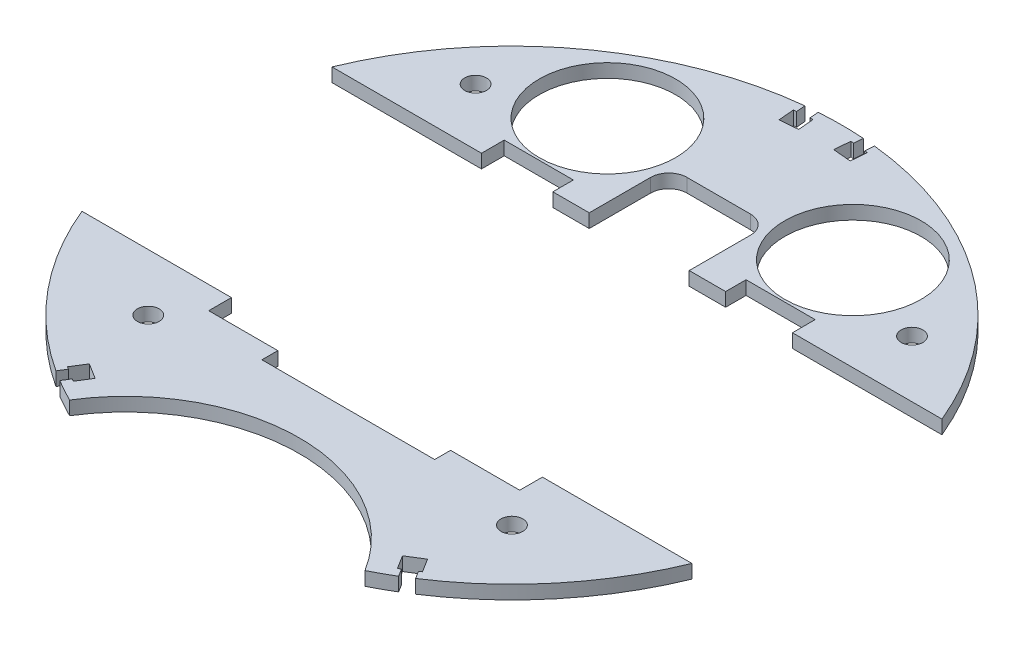
from build123d import *

# Parameters (mm, degrees)
BOSS_EXTRUDE1_DEPTH  = 3
SOLENOID_PLACEMENT_W = 38
SOLENOID_PLACEMENT_H = 64
CUT_EXTRUDE1_DEPTH   = 103.574363269
SKETCH3_R            = 12
CUT_EXTRUDE3_DEPTH   = 103.574363269
SKETCH4_R            = 2.4
CUT_EXTRUDE4_DEPTH   = 103.574363269
CUT_EXTRUDE2_DEPTH   = 103.574363269
CUT_EXTRUDE5_DEPTH   = 99.819279495
SKETCH6_R            = 15
CUT_EXTRUDE10_DEPTH  = 99.819279495
CUT_EXTRUDE11_DEPTH  = 99.819279495


with BuildPart() as part:
    # Sketch1 → Boss-Extrude1 (new body)
    with BuildSketch(Plane(origin=(0, 0, 0), x_dir=(1, 0, 0), z_dir=(0, 1, 0))):
        with BuildLine():
            ThreePointArc((32.48910875, -64.812867647), (0, 72.5), (-32.48910875, -64.812867647))
            ThreePointArc((-32.48910875, -64.812867647), (0, -46.75), (32.48910875, -64.812867647))
        make_face()
    extrude(amount=BOSS_EXTRUDE1_DEPTH)

    # solenoid placement → Cut-Extrude1 (cut, through all)
    with BuildSketch(Plane(origin=(0, 3, 0), x_dir=(1, 0, 0), z_dir=(0, 1, 0))):
        with Locations((0, -4)):
            Rectangle(SOLENOID_PLACEMENT_W, SOLENOID_PLACEMENT_H)
    extrude(amount=-CUT_EXTRUDE1_DEPTH, mode=Mode.SUBTRACT)

    # Sketch3 → Cut-Extrude3 (cut, through all)
    with BuildSketch(Plane(origin=(0, 3, 0), x_dir=(1, 0, 0), z_dir=(0, 1, 0))):
        with Locations((27, 48)):
            Circle(SKETCH3_R)
        with Locations((-27, 48)):
            Circle(SKETCH3_R)
    extrude(amount=-CUT_EXTRUDE3_DEPTH, mode=Mode.SUBTRACT)

    # Sketch4 → Cut-Extrude4 (cut, through all)
    with BuildSketch(Plane(origin=(0, 3, 0), x_dir=(1, 0, 0), z_dir=(0, 1, 0))):
        with Locations((40, -40)):
            Circle(SKETCH4_R)
        with Locations((-40, -40)):
            Circle(SKETCH4_R)
        with Locations((48, 40)):
            Circle(SKETCH4_R)
        with Locations((-48, 40)):
            Circle(SKETCH4_R)
    extrude(amount=-CUT_EXTRUDE4_DEPTH, mode=Mode.SUBTRACT)

    # Sketch2 → Cut-Extrude2 (cut, through all)
    with BuildSketch(Plane(origin=(0, 3, 0), x_dir=(1, 0, 0), z_dir=(0, 1, 0))):
        with BuildLine():
            Line((34.2, -27.5), (34.2, -32.5))
            Line((34.2, -32.5), (22.2, -32.5))
            Line((22.2, -32.5), (19, -32.5))
            Line((19, -32.5), (19, 32.5))
            Line((19, 32.5), (22.2, 32.5))
            Line((22.2, 32.5), (34.2, 32.5))
            Line((34.2, 32.5), (34.2, 27.5))
            Line((34.2, 27.5), (67.082039325, 27.5))
            ThreePointArc((67.082039325, 27.5), (72.5, 0), (67.082039325, -27.5))
            Line((67.082039325, -27.5), (34.2, -27.5))
        make_face()
        with BuildLine():
            Line((-34.2, -32.5), (-22.2, -32.5))
            Line((-22.2, -32.5), (-19, -32.5))
            Line((-19, -32.5), (-19, 32.5))
            Line((-19, 32.5), (-22.2, 32.5))
            Line((-22.2, 32.5), (-34.2, 32.5))
            Line((-34.2, 32.5), (-34.2, 27.5))
            Line((-34.2, 27.5), (-67.082039325, 27.5))
            ThreePointArc((-67.082039325, 27.5), (-72.5, 0), (-67.082039325, -27.5))
            Line((-67.082039325, -27.5), (-34.2, -27.5))
            Line((-34.2, -27.5), (-34.2, -32.5))
        make_face()
    extrude(amount=-CUT_EXTRUDE2_DEPTH, mode=Mode.SUBTRACT)


with BuildPart() as cut_extrude2_piece_1:
    # of the separate pieces the step leaves, piece 1, a body of its own (cut_extrude2_pieces)
    add(part.part.solids().sort_by_distance((67.082039325, 0, -27.5))[0])

    # Sketch5 → Cut-Extrude5 (cut, through all)
    with BuildSketch(Plane(origin=(0, 3, 0), x_dir=(1, 0, 0), z_dir=(0, 1, 0))):
        with BuildLine():
            Line((-11, 41.5), (-11, 28))
            Line((-11, 28), (11, 28))
            Line((11, 28), (11, 41.5))
            ThreePointArc((11, 41.5), (9.828427125, 44.328427125), (7, 45.5))
            Line((7, 45.5), (-7, 45.5))
            ThreePointArc((-7, 45.5), (-9.828427125, 44.328427125), (-11, 41.5))
        make_face()
    extrude(amount=-CUT_EXTRUDE5_DEPTH, mode=Mode.SUBTRACT)

    # Sketch6 → Cut-Extrude10 (cut, through all)
    with BuildSketch(Plane(origin=(0, 3, 0), x_dir=(-1, 0, 0), z_dir=(0, 1, 0))):
        with Locations((-27, -48)):
            Circle(SKETCH6_R)
        with Locations((27, -48)):
            Circle(SKETCH6_R)
    extrude(amount=-CUT_EXTRUDE10_DEPTH, mode=Mode.SUBTRACT)


with BuildPart() as cut_extrude2_piece_2:
    # of the separate pieces the step leaves, piece 2, a body of its own (cut_extrude2_pieces)
    add(part.part.solids().sort_by_distance((32.48910875, 0, 64.812867647))[0])


with BuildPart() as cut_extrude11_tool:
    # Sketch7 → Cut-Extrude11 (new, through all)
    with BuildSketch(Plane(origin=(0, 3, 0), x_dir=(1, 0, 0), z_dir=(0, 1, 0))):
        Polygon((-7.489342706, 70.114065963), (-8.13686926, 70.05741473), (-7.83182416, 66.570733287), (-3.847045368, 66.919356258), (-4.152090468, 70.406037701), (-4.799617021, 70.349386468), (-4.973928507, 72.341775864), (-7.663654192, 72.106455359), align=None)
        Polygon((8.13686926, 70.05741473), (7.489342706, 70.114065963), (7.663654192, 72.106455359), (4.973928507, 72.341775864), (4.799617021, 70.349386468), (4.152090468, 70.406037701), (3.847045368, 66.919356258), (7.83182416, 66.570733287), align=None)
        Polygon((38.504173058, -59.071999772), (39.055404321, -58.727552251), (37.200686896, -55.759383914), (33.808494511, -57.879060971), (35.663211936, -60.847229307), (36.214443199, -60.502781786), (37.274281727, -62.198877978), (39.564011587, -60.768095965), align=None)
        Polygon((-39.055404321, -58.727552251), (-38.504173058, -59.071999772), (-39.564011587, -60.768095965), (-37.274281727, -62.198877978), (-36.214443199, -60.502781786), (-35.663211936, -60.847229307), (-33.808494511, -57.879060971), (-37.200686896, -55.759383914), align=None)
    extrude(amount=-CUT_EXTRUDE11_DEPTH)


with BuildPart() as cut_extrude2_piece_1_1:
    add(cut_extrude2_piece_1.part)

    # Cut-Extrude11: cut by cut_extrude11_tool
    add(cut_extrude11_tool.part, mode=Mode.SUBTRACT)


with BuildPart() as cut_extrude2_piece_2_1:
    add(cut_extrude2_piece_2.part)

    # Cut-Extrude11: cut by cut_extrude11_tool
    add(cut_extrude11_tool.part, mode=Mode.SUBTRACT)


solid = Compound([cut_extrude2_piece_1_1.part, cut_extrude2_piece_2_1.part])
